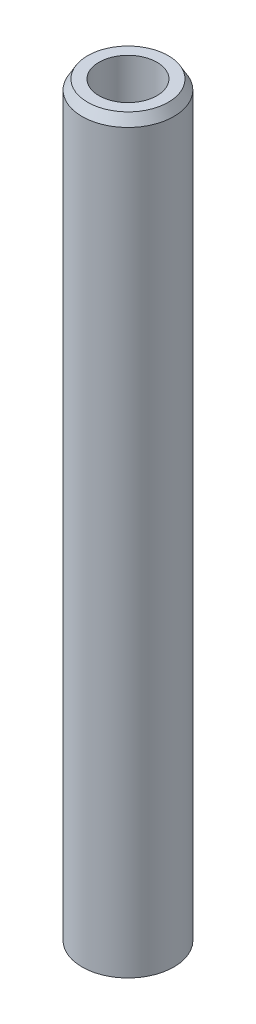
from build123d import *
from OCP.BRepFilletAPI import BRepFilletAPI_MakeChamfer

# Parameters (mm, degrees)
SKETCH1_R           = 20
BOSS_EXTRUDE1_DEPTH = 327.546325238
SKETCH2_R           = 12.639619362
CUT_EXTRUDE1_DEPTH  = 329.76525847
CHAMFER1_SIZE       = 4.178773936
CHAMFER1_SIZE2      = 2.412616257


with BuildPart() as part:
    # Sketch1 → Boss-Extrude1 (new body)
    with BuildSketch(Plane(origin=(0, 0, 0), x_dir=(1, 0, 0), z_dir=(0, 1, 0))):
        Circle(SKETCH1_R)
    extrude(amount=BOSS_EXTRUDE1_DEPTH)

    # Sketch2 → Cut-Extrude1 (cut, through all)
    with BuildSketch(Plane(origin=(0, 0, 0), x_dir=(1, 0, 0), z_dir=(0, 1, 0))):
        Circle(SKETCH2_R)
    extrude(amount=CUT_EXTRUDE1_DEPTH, mode=Mode.SUBTRACT)

    # Chamfer1: one chamfer whose edges measure the first distance from different faces: ONE call of the kernel's chamfer builder (chamfer() names one face for all edges)
    chamfer1_edges_1 = [part.edges().sort_by_distance(p)[0] for p in [
        (-20, 327.546325238, 0),
    ]]
    chamfer1_side_1 = [part.faces().sort_by_distance(p)[0] for p in [
        (-20, 163.773162619, 0),
    ]]
    chamfer1_edges_2 = [part.edges().sort_by_distance(p)[0] for p in [
        (-20, 0, 0),
    ]]
    chamfer1_side_2 = [part.faces().sort_by_distance(p)[0] for p in [
        (-19.434314575, 0, 0),
    ]]
    chamfer1 = BRepFilletAPI_MakeChamfer(part.part.solid().wrapped)
    for e in chamfer1_edges_1:
        chamfer1.Add(CHAMFER1_SIZE, CHAMFER1_SIZE2, e.wrapped, chamfer1_side_1[0].wrapped)  # the first distance lies on this face
    for e in chamfer1_edges_2:
        chamfer1.Add(CHAMFER1_SIZE, CHAMFER1_SIZE2, e.wrapped, chamfer1_side_2[0].wrapped)  # the first distance lies on this face
    add(Compound.cast(chamfer1.Shape()), mode=Mode.REPLACE)


solid = part.part
